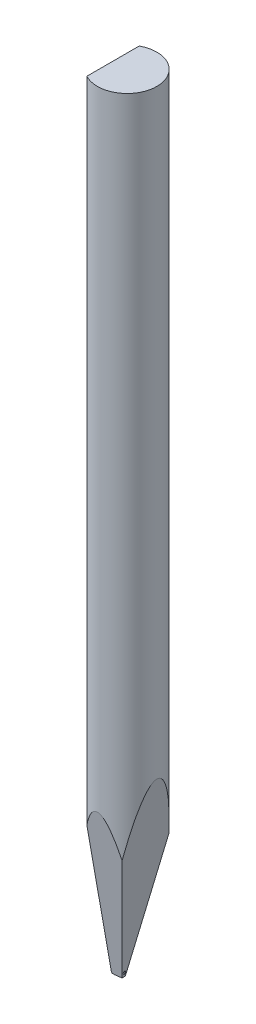
from build123d import *

# Parameters (mm, degrees)
TD_SKETCH_R                             = 0.79248
TL_FEATURE_DEPTH                        = 21.0312
TDF_STD_SKETCH_W                        = 2.09296
TDF_STD_SKETCH_H                        = 2.09296
TDF_STD_FEATURE_DEPTH                   = 22.061040395
ISA_20_STD_FEATURE_DEPTH                = 22.061040395
ISA_20_STD_FEATURE_DEPTH_BACK           = 22.061040395
F_10BA_STD_FEATURE_DEPTH                = 22.061040395
F_10BA_STD_FEATURE_DEPTH_BACK           = 22.061040395
FRO_STD_FEATURE_DEPTH                   = 22.061040395
FRO_STD_FEATURE_DEPTH_BACK              = 22.061040395
C_STD_FEATURE_DEPTH                     = 22.061040395
C_STD_FEATURE_DEPTH_BACK                = 22.061040395
ERW_STD_FEATURE_DEPTH                   = 0.01905
H_STD_FEATURE_REACH                     = 22.955
H_STD_SKETCH_R                          = 0.01905
H_STD_SKETCH_3_R                        = 0.01905
FUNNEL_FINAL_DIAMETRE_STD_FEATURE_DEPTH = 2.499995
FUNNEL_FINAL_DIAMETRE_STD_FEATURE_DRAFT = -22.5
ROUND_BR_STD_FEATURE_START              = -1
ROUND_BR_STD_FEATURE_DEPTH              = 0.939082249


with BuildPart() as part:
    # TD_sketch → TL_feature (new body)
    with BuildSketch(Plane(origin=(0, 0, 0), x_dir=(1, 0, 0), z_dir=(0, 1, 0))):
        with Locations(Location((0, 0, 0), (0, 0, 270))):
            Circle(TD_SKETCH_R)
    extrude(amount=TL_FEATURE_DEPTH)

    # TDF_STD_sketch → TDF_STD_feature (cut, through all)
    with BuildSketch(Plane(origin=(0, 0, 0), x_dir=(1, 0, 0), z_dir=(0, 1, 0))):
        with Locations((-1.4224, 0)):
            Rectangle(TDF_STD_SKETCH_W, TDF_STD_SKETCH_H)
    extrude(amount=TDF_STD_FEATURE_DEPTH, mode=Mode.SUBTRACT)

    # ISA_20_STD_sketch → ISA_20_STD_feature (cut, two sides: drawn at the far end of the back side and taken through both)
    with BuildSketch(Plane(origin=(0, 0, 0), x_dir=(0, 0, -1), z_dir=(1, 0, 0)).offset(-ISA_20_STD_FEATURE_DEPTH_BACK)):
        Polygon((-12.955177728, 73.256388083), (-3.746467997, 21.0312), (-0.0381, 0), (0.0381, 0), (3.746467997, 21.0312), (12.955177728, 73.256388083), (12.955177728, -32.805303497), (-12.955177728, -32.805303497), align=None)
    extrude(amount=ISA_20_STD_FEATURE_DEPTH + ISA_20_STD_FEATURE_DEPTH_BACK, mode=Mode.SUBTRACT)

    # 10BA_STD_sketch → 10BA_STD_feature (cut, two sides: drawn at the far end of the back side and taken through both)
    with BuildSketch(Plane.XY.offset(-F_10BA_STD_FEATURE_DEPTH_BACK)):
        Polygon((-53.187771959, 0), (-0.37592, 0), (-0.29972, 0), (-0.091356515, 0.029283578), (3.611847997, 21.0312), (12.782529849, 73.04072126), (91.167207296, 2.243763904), (25.196905488, -70.796957355), align=None)
    extrude(amount=F_10BA_STD_FEATURE_DEPTH + F_10BA_STD_FEATURE_DEPTH_BACK, mode=Mode.SUBTRACT)

    # FRO_STD_sketch → FRO_STD_feature (cut, two sides: drawn at the far end of the back side and taken through both)
    with BuildSketch(Plane.XY.offset(-FRO_STD_FEATURE_DEPTH_BACK)):
        with BuildLine():
            Line((-0.37592, 52.149873762), (-0.37592, 0.0254))
            ThreePointArc((-0.37592, 0.0254), (-0.368480512, 0.007439488), (-0.35052, 0))
            Line((-0.35052, 0), (51.773953762, 0))
            Line((51.773953762, 0), (-21.941183964, -73.715137726))
            Line((-21.941183964, -73.715137726), (-74.091057726, -21.565263964))
            Line((-74.091057726, -21.565263964), (-0.37592, 52.149873762))
        make_face()
    extrude(amount=FRO_STD_FEATURE_DEPTH + FRO_STD_FEATURE_DEPTH_BACK, mode=Mode.SUBTRACT)

    # C_STD_sketch → C_STD_feature (cut, two sides: drawn at the far end of the back side and taken through both)
    with BuildSketch(Plane(origin=(0, 0, 0), x_dir=(0, 0, -1), z_dir=(1, 0, 0)).offset(-C_STD_FEATURE_DEPTH_BACK)):
        with BuildLine():
            Line((-51.36762506, -8.882670253), (-0.03551364, 0))
            ThreePointArc((-0.03551364, 0), (0, 0.003050032), (0.03551364, 0))
            Line((0.03551364, 0), (51.36762506, -8.882670253))
            Line((51.36762506, -8.882670253), (51.36762506, -113.072640858))
            Line((51.36762506, -113.072640858), (-51.36762506, -113.072640858))
            Line((-51.36762506, -113.072640858), (-51.36762506, -8.882670253))
        make_face()
    extrude(amount=C_STD_FEATURE_DEPTH + C_STD_FEATURE_DEPTH_BACK, mode=Mode.SUBTRACT)


with BuildPart() as body_2:
    # ERW_STD_sketch → ERW_STD_feature (new, symmetric)
    with BuildSketch(Plane.XY):
        Polygon((-0.182120032, 0.06096), (-0.182120032, 0), (-0.321820032, 0), (-0.275883377, 0.06096), align=None)
    extrude(amount=ERW_STD_FEATURE_DEPTH, both=True)

    # H_STD_sketch → H_STD_feature (add, up to next)
    with BuildSketch(Plane(origin=(-0.096909952, 0.110156063, 0), x_dir=(0, 0, -1), z_dir=(0.8660254037844415, 0.4999999999999953, 0)), mode=Mode.PRIVATE) as h_std_feature_sk1:
        with Locations(Location((0, 0, 0), (0, 0, 90))):
            Circle(H_STD_SKETCH_R)
    h_std_feature_tool1 = extrude(h_std_feature_sk1.sketch, amount=-H_STD_FEATURE_REACH, mode=Mode.PRIVATE) - body_2.part
    add(h_std_feature_tool1.solids().sort_by_distance((-0.09691, 0.110156, 0))[0])


with BuildPart() as funnel_final_diametre_std_feature_tool:
    # H_STD_sketch<3> → funnel_final_diametre_STD_feature (with draft: the straight prism first)
    with BuildSketch(Plane(origin=(-0.096909952, 0.110156063, 0), x_dir=(0, 0, -1), z_dir=(0.8660254037844415, 0.4999999999999953, 0))):
        with Locations(Location((0, 0, 0), (0, 0, 90))):
            Circle(H_STD_SKETCH_3_R)
    extrude(amount=FUNNEL_FINAL_DIAMETRE_STD_FEATURE_DEPTH)
    # funnel_final_diametre_STD_feature: the draft: its side faces are tilted about the plane it starts from
    funnel_final_diametre_std_feature_sides = [funnel_final_diametre_std_feature_tool.faces().sort_by_distance(p)[0] for p in [
        (0.995144638, 0.718657029, 0),
    ]]
    draft(funnel_final_diametre_std_feature_sides, Plane(origin=(-0.096909952, 0.110156063, 0), x_dir=(0, 0, -1), z_dir=(0.8660254037844415, 0.4999999999999953, 0)), FUNNEL_FINAL_DIAMETRE_STD_FEATURE_DRAFT)


with BuildPart() as body_2_1:
    add(body_2.part)

    # funnel_final_diametre_STD_feature: add funnel_final_diametre_std_feature_tool
    add(funnel_final_diametre_std_feature_tool.part)

    # ROUND_BR_STD_feature: read off the stored shape, not the designer's step
    # ROUND_BR_STD_feature outline → ROUND_BR_STD_feature (cut)
    with BuildSketch(Plane(origin=(0, 0, 0), x_dir=(0.79863551004729, -0.601815023152052, 0), z_dir=(0.601815023152052, 0.79863551004729, 0)).offset(ROUND_BR_STD_FEATURE_START)):
        with BuildLine():
            Line((-0.257016905, -0.01905), (-0.237966905, -0.01905))
            ThreePointArc((-0.237966905, -0.01905), (-0.251437289, -0.013470384), (-0.257016905, 0))
            Line((-0.257016905, 0), (-0.257016905, -0.01905))
        make_face()
        with BuildLine():
            Line((-0.257016905, 0.01905), (-0.257016905, 0))
            ThreePointArc((-0.257016905, 0), (-0.251437289, 0.013470384), (-0.237966905, 0.01905))
            Line((-0.237966905, 0.01905), (-0.257016905, 0.01905))
        make_face()
    extrude(amount=ROUND_BR_STD_FEATURE_DEPTH, mode=Mode.SUBTRACT)


with BuildPart() as part_1:
    add(part.part)

    # COMBINE_STD_feature: cut body 2
    add(body_2_1.part, mode=Mode.SUBTRACT)


solid = part_1.part
